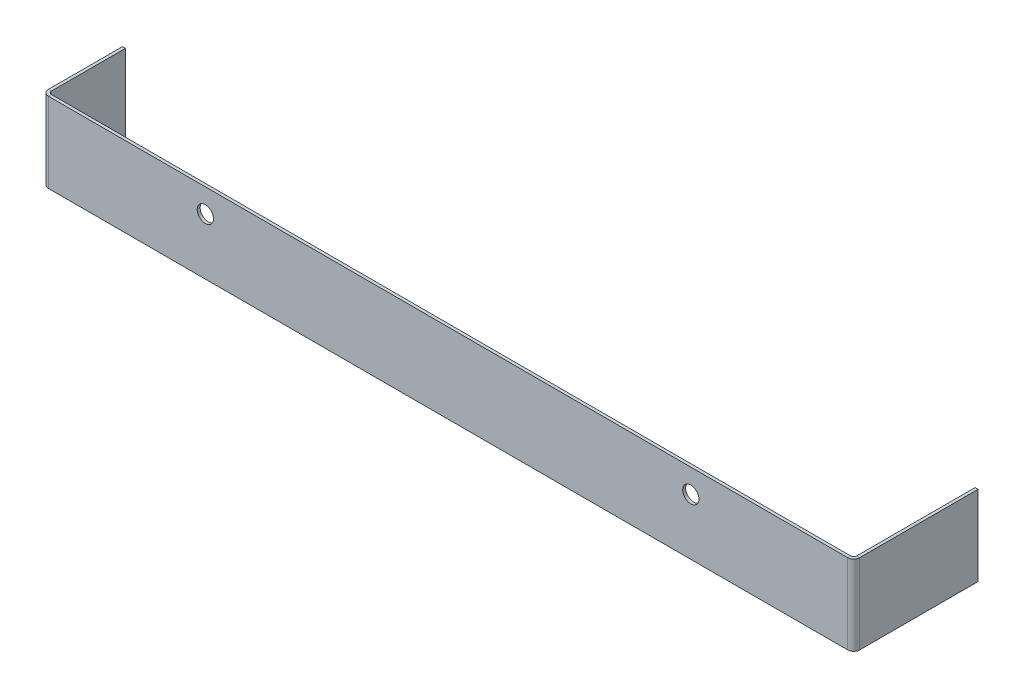
from build123d import *

# Parameters (mm, degrees)
SKETCH1_W            = 270
SKETCH1_H            = 27
BASE_FLANGE1_DEPTH   = 1
EDGE_FLANGE1_DEPTH   = 27
EDGE_FLANGE2_DEPTH   = 27
M5_CLEARANCE_HOLE1_D = 5.5


# Sheet-metal steps are written as plain solids
with BuildPart() as part:
    # Sketch1 → Base-Flange1 (new body)
    with BuildSketch(Plane.XY):
        Rectangle(SKETCH1_W, SKETCH1_H)
    extrude(amount=-BASE_FLANGE1_DEPTH)

    # Edge-Flange1 section (across the edge) → Edge-Flange1 (add)
    with BuildSketch(Plane(origin=(136, 13.5, -1), x_dir=(-1, 0, 0), z_dir=(0, -1, 0))):
        with BuildLine():
            Line((-1, 1), (-1, 41))
            Line((-1, 41), (0, 41))
            Line((0, 41), (0, 1))
            ThreePointArc((0, 1), (0.292893219, 0.292893219), (1, 0))
            Line((1, 0), (1, -1))
            ThreePointArc((1, -1), (-0.414213562, -0.414213562), (-1, 1))
        make_face()
    extrude(amount=EDGE_FLANGE1_DEPTH)

    # Edge-Flange2 section (across the edge) → Edge-Flange2 (add)
    with BuildSketch(Plane(origin=(-136, -13.5, -1), x_dir=(1, 0, 0), z_dir=(0, 1, 0))):
        with BuildLine():
            Line((-1, 1), (-1, 26))
            Line((-1, 26), (0, 26))
            Line((0, 26), (0, 1))
            ThreePointArc((0, 1), (0.292893219, 0.292893219), (1, 0))
            Line((1, 0), (1, -1))
            ThreePointArc((1, -1), (-0.414213562, -0.414213562), (-1, 1))
        make_face()
    extrude(amount=EDGE_FLANGE2_DEPTH)

    # M5 Clearance Hole1 (through all)
    with Locations(Plane.XY):
        with Locations((82, 5.5), (-82, 5.5)):
            Hole(M5_CLEARANCE_HOLE1_D / 2)


solid = part.part
